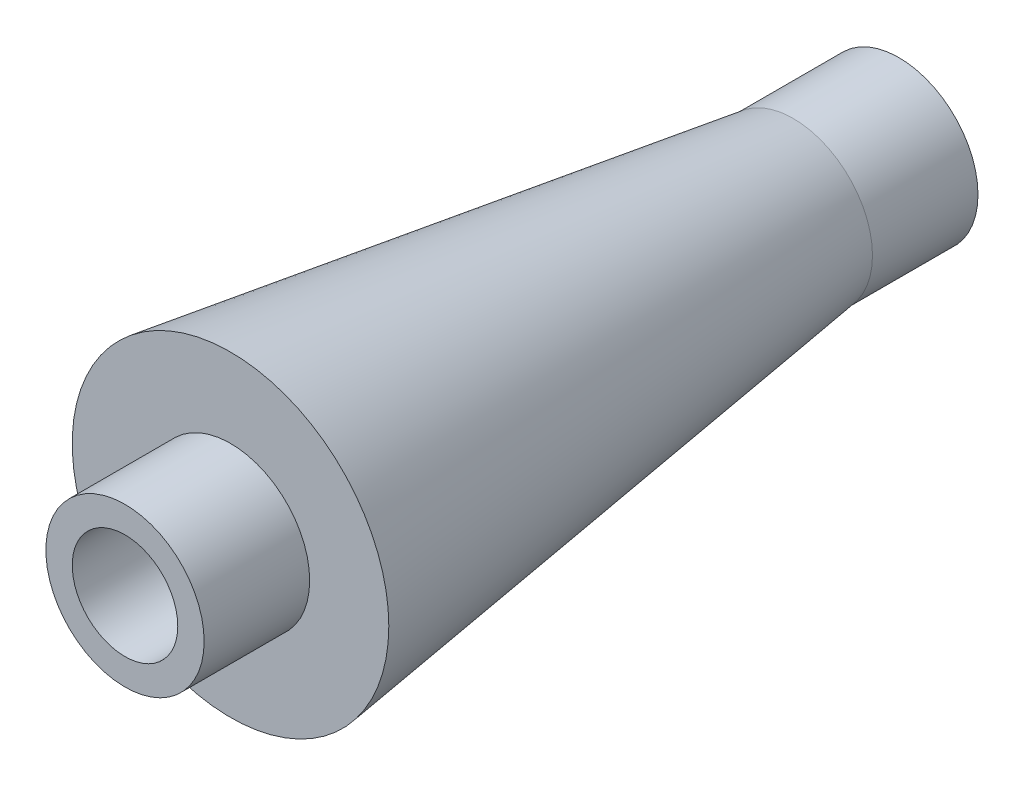
from build123d import *


with BuildPart() as part:
    # Sketch1 → Revolve1 (revolve)
    with BuildSketch(Plane(origin=(0, 0, 0), x_dir=(1, 0, 0), z_dir=(0, 1, 0))):
        Polygon((7.14375, 9.525), (7.14375, 19.05), (14.2875, 19.05), (7.14375, 69.85), (7.14375, 79.375), (4.7625, 79.375), (4.7625, 9.525), align=None)
    revolve(axis=Axis((0, 0, 1.5875), (0, 0, -1)))


solid = part.part
